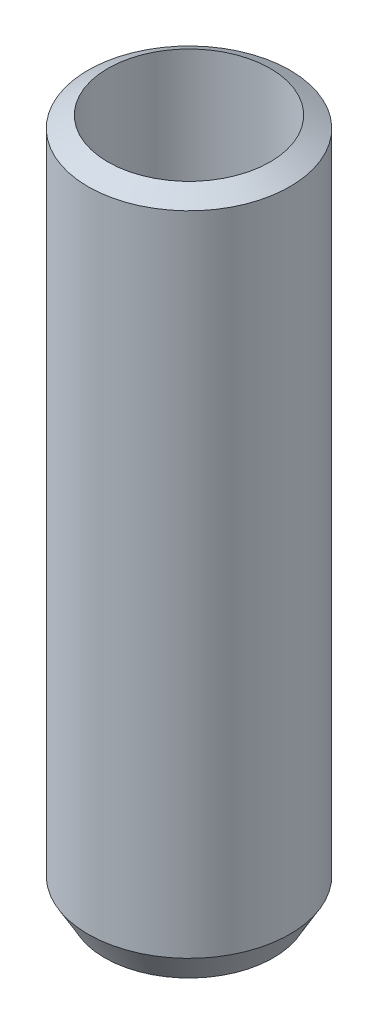
from build123d import *

# Parameters (mm, degrees)
SKETCH1_R           = 35
BOSS_EXTRUDE1_DEPTH = 240.218123
SKETCH2_R           = 28.120485596
CUT_EXTRUDE1_DEPTH  = 246.264646082
CHAMFER1_SIZE       = 5.769984
CHAMFER1_SIZE_2     = 9.993906


with BuildPart() as part:
    # Sketch1 → Boss-Extrude1 (new body)
    with BuildSketch(Plane(origin=(0, 0, 0), x_dir=(1, 0, 0), z_dir=(0, 1, 0))):
        with Locations(Location((0, 0, 0), (0, 0, 270))):
            Circle(SKETCH1_R)
    extrude(amount=BOSS_EXTRUDE1_DEPTH)

    # Sketch2 → Cut-Extrude1 (cut, through all)
    with BuildSketch(Plane(origin=(0, 0, 0), x_dir=(1, 0, 0), z_dir=(0, 1, 0))):
        with Locations(Location((0, 0, 0), (0, 0, 270))):
            Circle(SKETCH2_R)
    extrude(amount=CUT_EXTRUDE1_DEPTH, mode=Mode.SUBTRACT)

    # Chamfer1
    # the kernel refuses this chamfer: 9.993906, 5.769984 mm, written as the material it takes off along each edge
    with BuildSketch(Plane(origin=(0, 240.218123, 0), x_dir=(0, 0, 1), z_dir=(-1, 0, 0))) as chamfer1_piece_1:
        Polygon((35, -CHAMFER1_SIZE), (35 - CHAMFER1_SIZE_2, 0), (35, 0), align=None)
    revolve(axis=Axis((0, 240.218123, 0), (0, 1, 0)), mode=Mode.SUBTRACT)
    with BuildSketch(Plane(origin=(0, 0, 0), x_dir=(0, 0, 1), z_dir=(-1, 0, 0))) as chamfer1_piece_2:
        Polygon((35, CHAMFER1_SIZE_2), (35 - CHAMFER1_SIZE, 0), (35, 0), align=None)
    revolve(axis=Axis((0, 0, 0), (0, 1, 0)), mode=Mode.SUBTRACT)


solid = part.part
